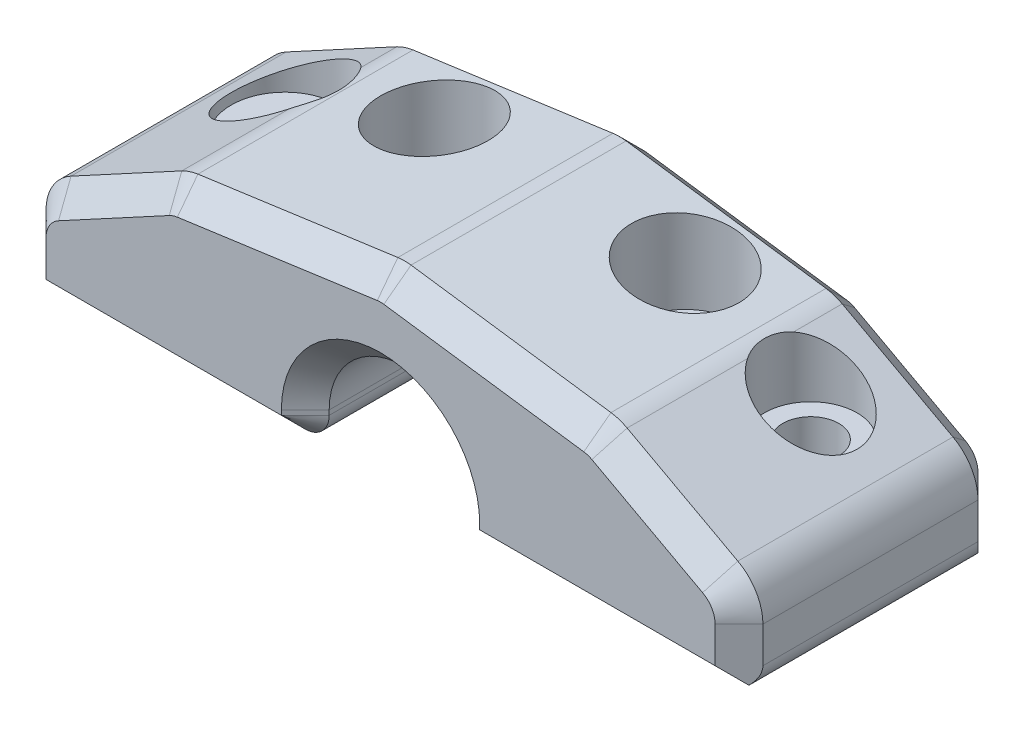
from build123d import *

# Parameters (mm, degrees)
BOSS_EXTRUDE1_DEPTH     = 11
CUT_EXTRUDE1_DEPTH      = 20.874606914
CUT_EXTRUDE1_DEPTH_BACK = 20.874606914
SKETCH3_W               = 11.85
SKETCH3_H               = 1.196323822
BOSS_EXTRUDE2_DEPTH     = 11
CHAMFER1_SIZE           = 1
FILLET1_R               = 1
SKETCH4_R               = 1.175
CUT_EXTRUDE2_DEPTH      = 21.326822777
CUT_EXTRUDE3_START      = 3
SKETCH5_R               = 2.25
SKETCH5_R_2             = 1.939534676
CUT_EXTRUDE3_DEPTH      = 10
FILLET2_R               = 2
FILLET3_R               = 1
CHAMFER2_SIZE           = 1


# Some blends are built 0.0001 mm under size
with BuildPart() as part:
    # Sketch1 → Boss-Extrude1 (new body)
    with BuildSketch(Plane.XY):
        with BuildLine():
            Line((-3.15, 0), (-15, 0))
            Line((-15, 0), (-15, 7))
            Line((-15, 7), (15, 7))
            Line((15, 7), (15, 0))
            Line((15, 0), (3.15, 0))
            ThreePointArc((3.15, 0), (0, 3.15), (-3.15, 0))
        make_face()
    extrude(amount=BOSS_EXTRUDE1_DEPTH)

    # Sketch2 → Cut-Extrude1 (cut, two sides: drawn at the far end of the back side and taken through both)
    with BuildSketch(Plane.XY.offset(11).offset(-CUT_EXTRUDE1_DEPTH_BACK)):
        Polygon((-9, 5.75), (0, 7), (-15, 7), (-15, 2.504439372), align=None)
        Polygon((15, 7), (0, 7), (9, 5.75), (15, 2.504439372), align=None)
    extrude(amount=CUT_EXTRUDE1_DEPTH + CUT_EXTRUDE1_DEPTH_BACK, mode=Mode.SUBTRACT)

    # Sketch3 → Boss-Extrude2 (add)
    with BuildSketch(Plane.XY.offset(11)):
        with Locations((-9.075, -0.598161911)):
            Rectangle(SKETCH3_W, SKETCH3_H)
        with Locations((9.075, -0.598161911)):
            Rectangle(SKETCH3_W, SKETCH3_H)
    extrude(amount=-BOSS_EXTRUDE2_DEPTH)

    # Chamfer1
    chamfer1_edges = [part.edges().sort_by_distance(p)[0] for p in [
        (15, 0.654057775, 11),
        (-15, 0.654057775, 0),
        (-15, 0.654057775, 11),
        (15, 0.654057775, 0),
    ]]
    chamfer(chamfer1_edges, length=CHAMFER1_SIZE)

    # Fillet1
    fillet1_edges = [part.edges().sort_by_distance(p)[0] for p in [
        (-3.15, -1.196323822, 5.5),
        (3.15, -1.196323822, 5.5),
    ]]
    fillet(fillet1_edges, radius=FILLET1_R)

    # Sketch4 → Cut-Extrude2 (cut, through all)
    with BuildSketch(Plane.XZ.offset(1.196323822)):
        with Locations(Location((-5.25, 3.5, 0), (0, 0, 20.581969212))):
            Circle(SKETCH4_R)
        with Locations((5.25, 3.5)):
            Circle(SKETCH4_R)
        with Locations((-11, 4)):
            Circle(SKETCH4_R)
        with Locations((11, 4)):
            Circle(SKETCH4_R)
    extrude(amount=-CUT_EXTRUDE2_DEPTH, mode=Mode.SUBTRACT)

    # Sketch5 → Cut-Extrude3 (cut)
    with BuildSketch(Plane(origin=(0, 0, 0), x_dir=(1, 0, 0), z_dir=(0, 1, 0)).offset(CUT_EXTRUDE3_START)):
        with Locations(Location((-5.25, -3.5, 0), (0, 0, 180))):
            Circle(SKETCH5_R)
        with Locations((5.25, -3.5)):
            Circle(SKETCH5_R)
        with Locations(Location((-11, -4, 0), (0, 0, 27.266044451))):
            Circle(SKETCH5_R)
        with Locations((11, -4)):
            Circle(SKETCH5_R_2)
    extrude(amount=CUT_EXTRUDE3_DEPTH, mode=Mode.SUBTRACT)

    # Fillet2
    # the kernel refuses this fillet: 2 mm, written as the material it takes off along each edge
    with BuildSketch(Plane(origin=(9, 5.75, -2.170275709), x_dir=(-0.9904922731777516, 0.13756837127468827, 0), z_dir=(0, 0, 1))) as fillet2_piece_1:
        with BuildLine():
            CenterArc((FILLET2_R * 0.180856309082, FILLET2_R), FILLET2_R, 249.497020474, 20.502979526)
            Line((-FILLET2_R * 0.169399781042, FILLET2_R * 0.0633460236933), (-FILLET2_R * 0.176404902844, FILLET2_R * 0.0446129441672))
            Line((-FILLET2_R * 0.176404902844, FILLET2_R * 0.0446129441672), (-FILLET2_R * 0.00361712618164, -FILLET2_R * 0.02))
            Line((-FILLET2_R * 0.00361712618164, -FILLET2_R * 0.02), (FILLET2_R * 0.180856309082, -FILLET2_R * 0.02))
            Line((FILLET2_R * 0.180856309082, -FILLET2_R * 0.02), (FILLET2_R * 0.180856309082, 0))
        make_face()
    extrude(amount=15.340551418, mode=Mode.SUBTRACT)
    with BuildSketch(Plane(origin=(-9, 5.75, 5.139499303), x_dir=(-0.879564366325619, -0.4757799128696085, 0), z_dir=(0, 0, -1))) as fillet2_piece_2:
        with BuildLine():
            CenterArc((FILLET2_R * 0.180856309082, -FILLET2_R), FILLET2_R, 90, 20.502979526)
            Line((-FILLET2_R * 0.169399781042, -FILLET2_R * 0.0633460236933), (-FILLET2_R * 0.176404902844, -FILLET2_R * 0.0446129441672))
            Line((-FILLET2_R * 0.176404902844, -FILLET2_R * 0.0446129441672), (-FILLET2_R * 0.00361712618164, FILLET2_R * 0.02))
            Line((-FILLET2_R * 0.00361712618164, FILLET2_R * 0.02), (FILLET2_R * 0.180856309082, FILLET2_R * 0.02))
            Line((FILLET2_R * 0.180856309082, FILLET2_R * 0.02), (FILLET2_R * 0.180856309082, 0))
        make_face()
    extrude(amount=7.309775012, mode=Mode.SUBTRACT)
    with BuildSketch(Plane(origin=(-9, 5.75, 13.170275709), x_dir=(-0.879564366325619, -0.4757799128696085, 0), z_dir=(0, 0, -1))) as fillet2_piece_3:
        with BuildLine():
            CenterArc((FILLET2_R * 0.180856309082, -FILLET2_R), FILLET2_R, 90, 20.502979526)
            Line((-FILLET2_R * 0.169399781042, -FILLET2_R * 0.0633460236933), (-FILLET2_R * 0.176404902844, -FILLET2_R * 0.0446129441672))
            Line((-FILLET2_R * 0.176404902844, -FILLET2_R * 0.0446129441672), (-FILLET2_R * 0.00361712618164, FILLET2_R * 0.02))
            Line((-FILLET2_R * 0.00361712618164, FILLET2_R * 0.02), (FILLET2_R * 0.180856309082, FILLET2_R * 0.02))
            Line((FILLET2_R * 0.180856309082, FILLET2_R * 0.02), (FILLET2_R * 0.180856309082, 0))
        make_face()
    extrude(amount=10.309775012, mode=Mode.SUBTRACT)
    with BuildSketch(Plane(origin=(0, 7, 12.666666667), x_dir=(-0.9904922731777517, -0.13756837127468774, 0), z_dir=(0, 0, -1))) as fillet2_piece_4:
        with BuildLine():
            CenterArc((FILLET2_R * 0.138888888889, -FILLET2_R), FILLET2_R, 90, 15.814325406)
            Line((-FILLET2_R * 0.133631928674, -FILLET2_R * 0.0378501135503), (-FILLET2_R * 0.139082345025, -FILLET2_R * 0.0186071158213))
            Line((-FILLET2_R * 0.139082345025, -FILLET2_R * 0.0186071158213), (-FILLET2_R * 0.00277777777778, FILLET2_R * 0.02))
            Line((-FILLET2_R * 0.00277777777778, FILLET2_R * 0.02), (FILLET2_R * 0.138888888889, FILLET2_R * 0.02))
            Line((FILLET2_R * 0.138888888889, FILLET2_R * 0.02), (FILLET2_R * 0.138888888889, 0))
        make_face()
    extrude(amount=14.333333333, mode=Mode.SUBTRACT)
    with BuildSketch(Plane(origin=(-15, 2.504439372, -6.151996245), x_dir=(0.8795643663256194, 0.4757799128696078, 0), z_dir=(0, 0, 1))) as fillet2_piece_5:
        with BuildLine():
            CenterArc((FILLET2_R * 0.595999687118, -FILLET2_R), FILLET2_R, 90, 61.589857771)
            Line((-FILLET2_R * 0.283564679207, -FILLET2_R * 0.52422008713), (-FILLET2_R * 0.301155966534, -FILLET2_R * 0.514704488873))
            Line((-FILLET2_R * 0.301155966534, -FILLET2_R * 0.514704488873), (-FILLET2_R * 0.0119199937424, FILLET2_R * 0.02))
            Line((-FILLET2_R * 0.0119199937424, FILLET2_R * 0.02), (FILLET2_R * 0.595999687118, FILLET2_R * 0.02))
            Line((FILLET2_R * 0.595999687118, FILLET2_R * 0.02), (FILLET2_R * 0.595999687118, 0))
        make_face()
    extrude(amount=23.303992491, mode=Mode.SUBTRACT)
    with BuildSketch(Plane(origin=(15, 2.504439372, -6.151996245), x_dir=(-0.87956436632562, 0.47577991286960686, 0), z_dir=(0, 0, 1))) as fillet2_piece_6:
        with BuildLine():
            CenterArc((FILLET2_R * 0.595999687118, FILLET2_R), FILLET2_R, 208.410142229, 61.589857771)
            Line((-FILLET2_R * 0.283564679207, FILLET2_R * 0.52422008713), (-FILLET2_R * 0.301155966534, FILLET2_R * 0.514704488873))
            Line((-FILLET2_R * 0.301155966534, FILLET2_R * 0.514704488873), (-FILLET2_R * 0.0119199937424, -FILLET2_R * 0.02))
            Line((-FILLET2_R * 0.0119199937424, -FILLET2_R * 0.02), (FILLET2_R * 0.595999687118, -FILLET2_R * 0.02))
            Line((FILLET2_R * 0.595999687118, -FILLET2_R * 0.02), (FILLET2_R * 0.595999687118, 0))
        make_face()
    extrude(amount=23.303992491, mode=Mode.SUBTRACT)

    # Fillet3
    fillet3_edges = [part.edges().sort_by_distance(p)[0] for p in [
        (15, -1.196323822, 5.5),
        (-15, -1.196323822, 5.5),
    ]]
    fillet(fillet3_edges, radius=FILLET3_R)

    # Chamfer2
    chamfer2_edges = [part.edges().sort_by_distance(p)[0] for p in [
        (-11.634854678, 4.324736566, 0),
        (-11.634854678, 4.324736566, 11),
        (-8.989888283, 5.719170071, 0),
        (-8.989888283, 5.719170071, 11),
        (-4.458431595, 6.38077339, 0),
        (-4.458431595, 6.38077339, 11),
        (11.634854678, 4.324736566, 11),
        (11.634854678, 4.324736566, 0),
        (0, 6.980802017, 0),
        (0, 6.980802017, 11),
        (8.989888283, 5.719170071, 0),
        (8.989888283, 5.719170071, 11),
        (4.458431595, 6.38077339, 11),
        (4.458431595, 6.38077339, 0),
        (-9.075, -1.196323822, 0),
        (9.075, -1.196323822, 0),
        (-3.442893219, -0.903430603, 0),
        (-3.442893219, -0.903430603, 11),
        (3.442893219, -0.903430603, 11),
        (3.442893219, -0.903430603, 0),
        (-3.15, -0.098161911, 0),
        (3.15, -0.098161911, 0),
        (0, 3.15, 0),
        (0, 3.15, 11),
        (-9.075, -1.196323822, 11),
        (9.075, -1.196323822, 11),
        (-3.15, -0.098161911, 11),
        (3.15, -0.098161911, 11),
        (-13.975873835, 3.058197787, 0),
        (-13.975873835, 3.058197787, 11),
        (13.975873835, 3.058197787, 0),
        (13.975873835, 3.058197787, 11),
    ]]
    chamfer(chamfer2_edges, length=CHAMFER2_SIZE - 0.0001)  # a hair under: the kernel refuses the full size


solid = part.part
